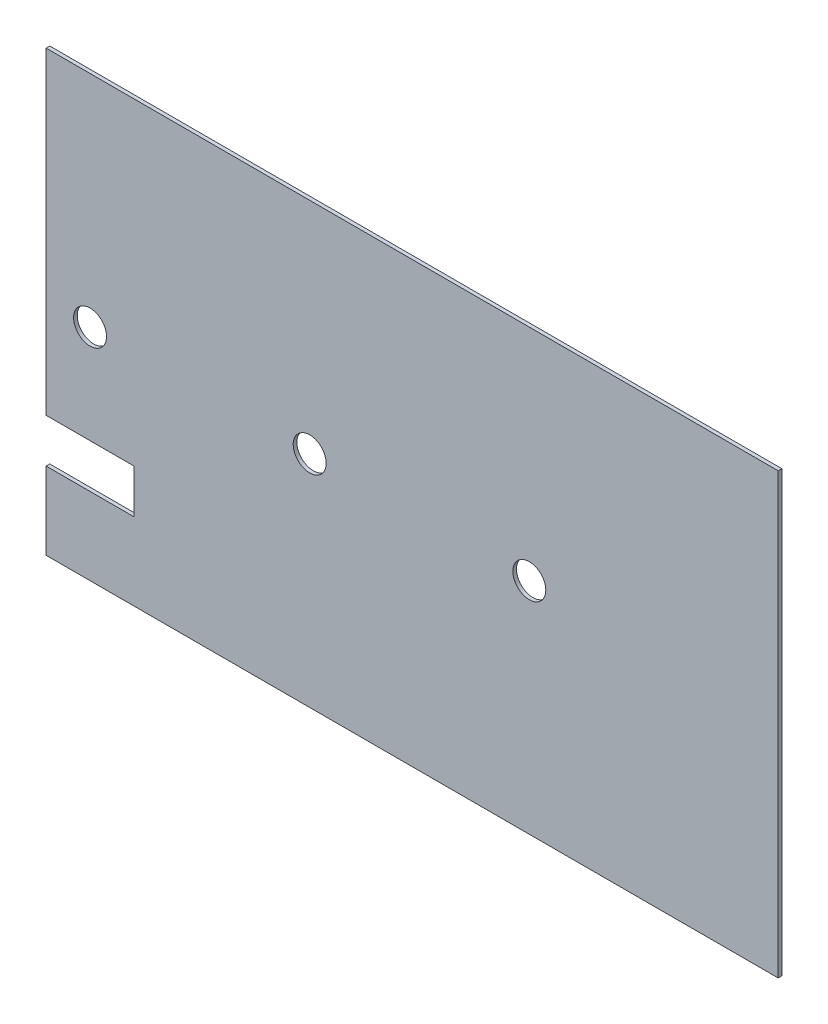
from build123d import *

# Parameters (mm, degrees)
SKETCH1_W           = 685.8
SKETCH1_H           = 381
BOSS_EXTRUDE1_DEPTH = 3.175
SKETCH2_R           = 14.2875
CUT_EXTRUDE1_DEPTH  = 785.533441368
SKETCH3_W           = 50.8
SKETCH3_H           = 381
CUT_EXTRUDE2_DEPTH  = 785.533441368
SKETCH5_W           = 76.2
SKETCH5_H           = 38.1
CUT_EXTRUDE3_DEPTH  = 785.533441368


with BuildPart() as part:
    # Sketch1 → Boss-Extrude1 (new body)
    with BuildSketch(Plane.XY):
        with Locations((342.9, 190.5)):
            Rectangle(SKETCH1_W, SKETCH1_H)
    extrude(amount=BOSS_EXTRUDE1_DEPTH)

    # Sketch2 → Cut-Extrude1 (cut, through all)
    with BuildSketch(Plane.XY.offset(3.175)):
        with Locations((469.9, 190.5)):
            Circle(SKETCH2_R)
        with Locations((88.9, 190.5)):
            Circle(SKETCH2_R)
        with Locations((279.4, 190.5)):
            Circle(SKETCH2_R)
    extrude(amount=-CUT_EXTRUDE1_DEPTH, mode=Mode.SUBTRACT)

    # Sketch3 → Cut-Extrude2 (cut, through all)
    with BuildSketch(Plane.XY.offset(3.175)):
        with Locations((25.4, 190.5)):
            Rectangle(SKETCH3_W, SKETCH3_H)
    extrude(amount=-CUT_EXTRUDE2_DEPTH, mode=Mode.SUBTRACT)

    # Sketch5 → Cut-Extrude3 (cut, through all)
    with BuildSketch(Plane.XY.offset(3.175)):
        with Locations((88.9, 86.106)):
            Rectangle(SKETCH5_W, SKETCH5_H)
    extrude(amount=-CUT_EXTRUDE3_DEPTH, mode=Mode.SUBTRACT)


solid = part.part
